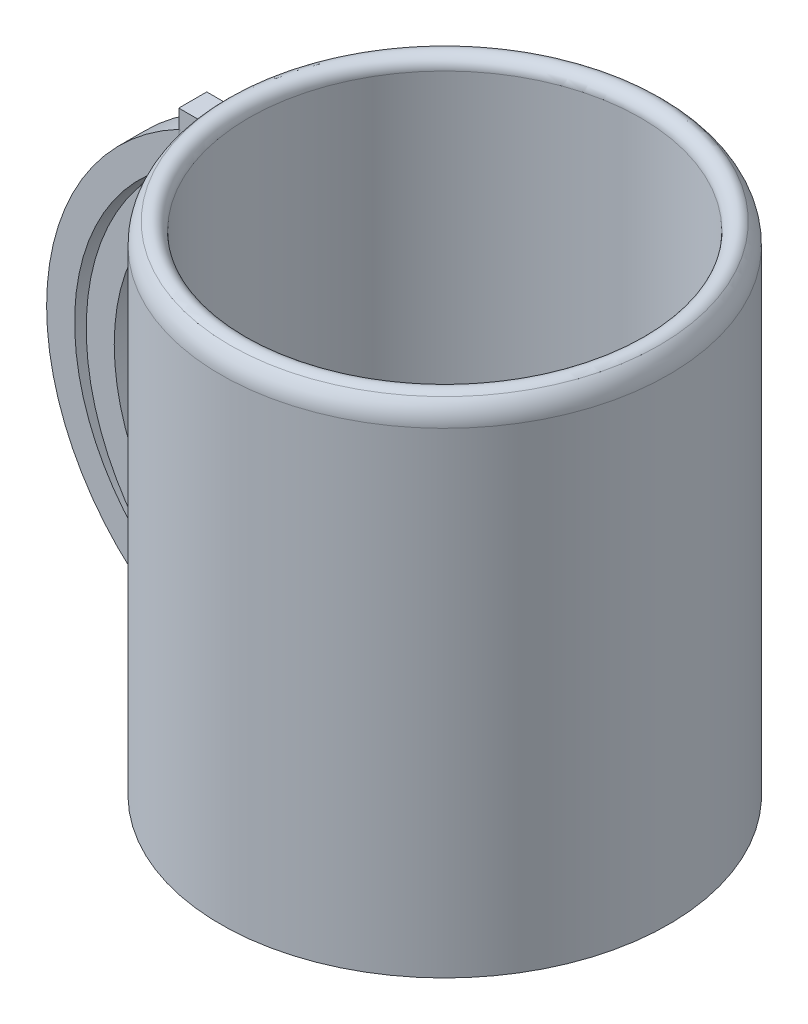
from build123d import *

# Parameters (mm, degrees)
ESBO_O3_W              = 40
ESBO_O3_H              = 90
ESBO_O9_R              = 35
CORTE_EXTRUS_O2_DEPTH  = 80
FILETE5_R              = 5
FILETE7_R              = 2
ESBO_O10_W             = 5
ESBO_O10_H             = 85
EXTRUS_O_FINA2_DEPTH   = 2.5
EXTRUS_O_FINA2_2_DEPTH = 2.5
EXTRUS_O_FINA2_3_DEPTH = 2.5


with BuildPart() as part:
    # Esboço3 → Revolução3 (revolve)
    with BuildSketch(Plane.XY, mode=Mode.PRIVATE) as revolu_o3_sk:
        with Locations((-20, 45)):
            Rectangle(ESBO_O3_W, ESBO_O3_H)
    revolve(revolu_o3_sk.sketch.rotate(Axis((0, 0, 0), (0, 1, 0)), 270), axis=Axis((0, 0, 0), (0, 1, 0)))

    # Esboço9 → Corte-extrusão2 (cut)
    with BuildSketch(Plane(origin=(0, 90, 0), x_dir=(1, 0, 0), z_dir=(0, 1, 0))):
        with Locations(Location((0, 0, 0), (0, 0, 270))):
            Circle(ESBO_O9_R)
    extrude(amount=-CORTE_EXTRUS_O2_DEPTH, mode=Mode.SUBTRACT)

    # Filete5
    filete5_edges = [part.edges().sort_by_distance(p)[0] for p in [
        (0, 90, 40),
    ]]
    fillet(filete5_edges, radius=FILETE5_R - 0.0001)  # a hair under: the kernel refuses the full size

    # Filete7
    filete7_edges = [part.edges().sort_by_distance(p)[0] for p in [
        (0, 90, -35),
    ]]
    fillet(filete7_edges, radius=FILETE7_R)


with BuildPart() as body_2:
    # Esboço10 → Extrusão-Fina2 (new, symmetric)
    with BuildSketch(Plane.XY):
        with Locations((-42.5, 42.5)):
            Rectangle(ESBO_O10_W, ESBO_O10_H)
    extrude(amount=EXTRUS_O_FINA2_DEPTH, both=True)


with BuildPart() as body_3:
    # Esboço10 → Extrus_o-Fina2 2 (new, symmetric)
    with BuildSketch(Plane.XY):
        with BuildLine():
            ThreePointArc((-40, 73.577519956), (-56.522136915, 42.685905601), (-40, 11.794291247))
            Line((-40, 11.794291247), (-42.775710518, 7.635513647))
            ThreePointArc((-42.775710518, 7.635513647), (-61.522136915, 42.685905601), (-42.775710518, 77.736297555))
            Line((-42.775710518, 77.736297555), (-40, 73.577519956))
        make_face()
    extrude(amount=EXTRUS_O_FINA2_2_DEPTH, both=True)


with BuildPart() as body_4:
    # Esboço10 → Extrus_o-Fina2 3 (new, symmetric)
    with BuildSketch(Plane.XY):
        with BuildLine():
            ThreePointArc((-40, 78.577519956), (-63.596209539, 42.607153315), (-40, 6.636786674))
            Line((-40, 6.636786674), (-41.991426841, 2.050478884))
            ThreePointArc((-41.991426841, 2.050478884), (-68.596209539, 42.607153315), (-41.991426841, 83.163827745))
            Line((-41.991426841, 83.163827745), (-40, 78.577519956))
        make_face()
    extrude(amount=EXTRUS_O_FINA2_3_DEPTH, both=True)


solid = Compound([part.part, body_2.part, body_3.part, body_4.part])
